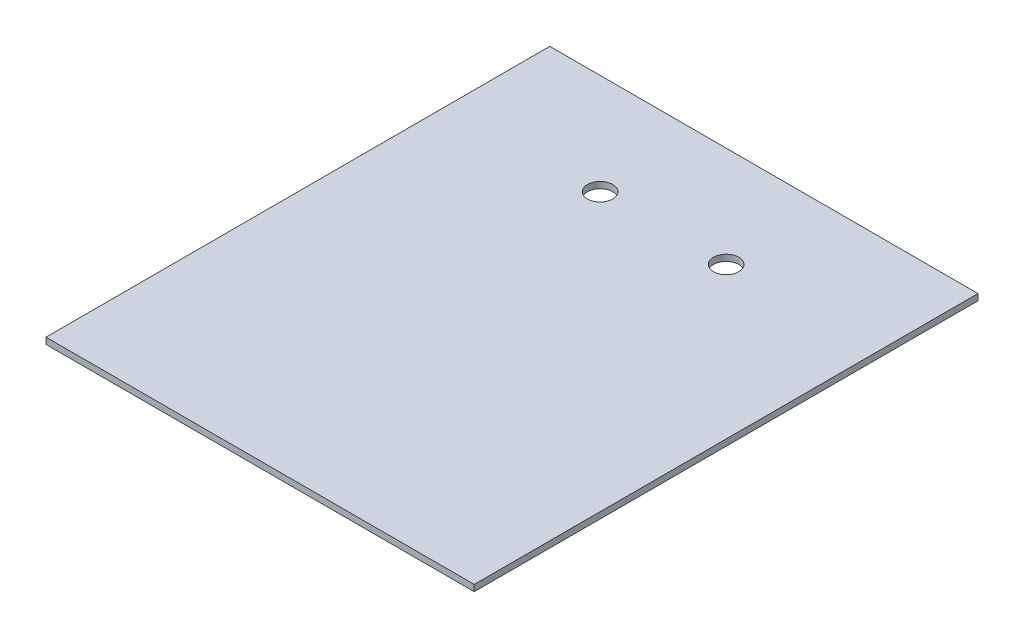
from build123d import *

# Parameters (mm, degrees)
SKETCH1_W           = 215.9
SKETCH1_H           = 254
BOSS_EXTRUDE1_DEPTH = 3.175
SKETCH2_R           = 6.35
CUT_EXTRUDE1_DEPTH  = 334.375


with BuildPart() as part:
    # Sketch1 → Boss-Extrude1 (new body)
    with BuildSketch(Plane(origin=(0, 0, 0), x_dir=(1, 0, 0), z_dir=(0, 1, 0))):
        with Locations((107.95, 127)):
            Rectangle(SKETCH1_W, SKETCH1_H)
    extrude(amount=BOSS_EXTRUDE1_DEPTH)

    # Sketch2 → Cut-Extrude1 (cut, through all)
    with BuildSketch(Plane(origin=(0, 3.175, 0), x_dir=(1, 0, 0), z_dir=(0, 1, 0))):
        with Locations((76.2, 203.2)):
            Circle(SKETCH2_R)
        with Locations((139.7, 203.2)):
            Circle(SKETCH2_R)
    extrude(amount=-CUT_EXTRUDE1_DEPTH, mode=Mode.SUBTRACT)


solid = part.part
